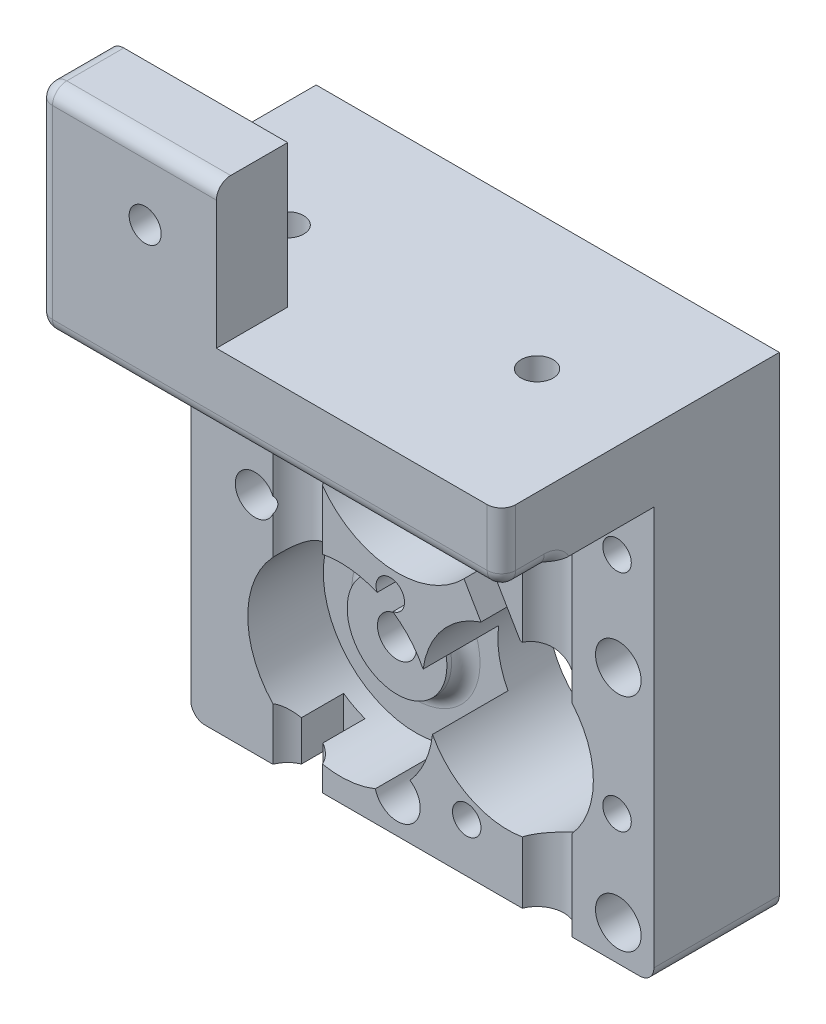
from build123d import *
from build123d.topology import SkipClean

# Parameters (mm, degrees)
SKETCH1_W                = 65
SKETCH1_H                = 68
SKETCH1_R                = 12
SKETCH1_R_2              = 1.75
SKETCH1_R_3              = 2.75
BOSS_EXTRUDE1_DEPTH      = 7
SKETCH2_R                = 7
SKETCH2_R_2              = 2.75
SKETCH2_R_3              = 4
BOSS_EXTRUDE2_DEPTH      = 2.65
SKETCH3_W                = 22
SKETCH3_H                = 10
BOSS_EXTRUDE3_DEPTH      = 65
SKETCH4_R                = 2.25
CUT_EXTRUDE1_DEPTH       = 10
SKETCH5_R                = 2.25
CUT_EXTRUDE2_DEPTH       = 10
BOSS_EXTRUDE5_START      = 5.9
SKETCH7_W                = 41
SKETCH7_H                = 41
SKETCH7_R                = 12
SKETCH7_R_2              = 1.75
BOSS_EXTRUDE5_DEPTH      = 5.9
SKETCH8_R                = 4
SKETCH8_R_2              = 2.75
BOSS_EXTRUDE6_DEPTH      = 7.95
CUT_EXTRUDE3_START       = -9.45
SKETCH10_R               = 2.75
CUT_EXTRUDE3_DEPTH       = 9.45
SKETCH11_W               = 65
SKETCH11_H               = 58
SKETCH11_R               = 1.75
SKETCH11_R_2             = 10
SKETCH11_R_3             = 4
SKETCH11_R_4             = 7.25
BOSS_EXTRUDE7_DEPTH      = 10
CUT_EXTRUDE4_DEPTH       = 7.35
CUT_EXTRUDE5_START       = -10
SKETCH13_R               = 7
CUT_EXTRUDE5_DEPTH       = 10
SKETCH14_R               = 3
CUT_EXTRUDE6_DEPTH       = 17
SKETCH15_R               = 3
SKETCH15_W               = 13.5
SKETCH15_H               = 6.252863579
BOSS_EXTRUDE9_DEPTH      = 3.5
SKETCH16_R               = 3
BOSS_EXTRUDE10_DEPTH     = 7.5
SKETCH17_W               = 65
SKETCH17_H               = 58
SKETCH17_R               = 3
BOSS_EXTRUDE11_DEPTH     = 3
SKETCH18_R               = 2.25
CUT_EXTRUDE7_DEPTH       = 91.140168626
SKETCH19_R               = 3.75
CUT_EXTRUDE8_DEPTH       = 58
FILLET2_R                = 2
CUT_EXTRUDE9_DEPTH       = 5.5
CUT_EXTRUDE10_DEPTH      = 29.5
SKETCH22_W               = 65
SKETCH22_H               = 58
CUT_EXTRUDE11_DEPTH      = 21.4
SKETCH23_R               = 1.8
CUT_EXTRUDE12_DEPTH      = 10
SKETCH24_R               = 2
CUT_EXTRUDE13_DEPTH      = 4
SKETCH26_W               = 41
SKETCH26_H               = 41
CUT_EXTRUDE14_DEPTH      = 5.9
BOSS_EXTRUDE12_START     = -10
BOSS_EXTRUDE12_DEPTH     = 10.6
BOSS_EXTRUDE13_DEPTH     = 0.6
SKETCH28_R               = 3.75
CUT_EXTRUDE15_DEPTH      = 58
CUT_EXTRUDE16_DEPTH      = 10
CUT_EXTRUDE16_DEPTH_BACK = 14
SKETCH32_R               = 3.2
CUT_EXTRUDE17_REACH      = 88.951
SKETCH34_R               = 11
SKETCH34_R_2             = 7
SKETCH35_R               = 12
CUT_EXTRUDE18_DEPTH      = 87.951135754
FILLET4_R                = 2
SKETCH36_R               = 3.2
SKETCH36_R_2             = 1.8
BOSS_EXTRUDE14_DEPTH     = 6.5
SKETCH37_W               = 40
SKETCH37_H               = 20
CUT_EXTRUDE19_DEPTH      = 86.892374568
CUT_EXTRUDE20_REACH      = 85.633
SKETCH38_R               = 13
SKETCH38_R_2             = 9


# Some blends are built 0.0001 mm under size
with BuildPart() as part:
    # Sketch1 → Boss-Extrude1 (new body)
    with BuildSketch(Plane.XY):
        with Locations((-12, 13.5)):
            Rectangle(SKETCH1_W, SKETCH1_H)
        Circle(SKETCH1_R, mode=Mode.SUBTRACT)
        with Locations((-15.5, 15.5)):
            Circle(SKETCH1_R_2, mode=Mode.SUBTRACT)
        with Locations((15.5, 15.5)):
            Circle(SKETCH1_R_2, mode=Mode.SUBTRACT)
        with Locations((15.5, -15.5)):
            Circle(SKETCH1_R_2, mode=Mode.SUBTRACT)
        with Locations((-15.5, -15.5)):
            Circle(SKETCH1_R_2, mode=Mode.SUBTRACT)
        with Locations((-15.5, 24.5)):
            Circle(SKETCH1_R_3, mode=Mode.SUBTRACT)
    extrude(amount=BOSS_EXTRUDE1_DEPTH)

    # Sketch2 → Boss-Extrude2 (add)
    # profile 1 of 3: a face of its own
    with BuildSketch(Plane.XY.offset(7)):
        with Locations((-23.5, -4.247136421)):
            Circle(SKETCH2_R)
        with Locations((-23.5, -4.247136421)):
            Circle(SKETCH2_R_2, mode=Mode.SUBTRACT)
    # profile 2 of 3: a face of its own
    with BuildSketch(Plane.XY.offset(7)):
        with Locations((-15.5, 24.5)):
            Circle(SKETCH2_R)
        with Locations((-15.5, 24.5)):
            Circle(SKETCH2_R_2, mode=Mode.SUBTRACT)
    # profile 3 of 3: a face of its own
    with BuildSketch(Plane.XY.offset(7)):
        with Locations((-35.5, 11)):
            Circle(SKETCH2_R_3)
        with Locations((-35.5, 11)):
            Circle(SKETCH2_R_2, mode=Mode.SUBTRACT)
    extrude(amount=BOSS_EXTRUDE2_DEPTH)

    # Sketch3 → Boss-Extrude3 (add, through all)
    with BuildSketch(Plane(origin=(20.5, 0, 0), x_dir=(0, 0, -1), z_dir=(1, 0, 0))):
        with Locations((-18, 42.5)):
            Rectangle(SKETCH3_W, SKETCH3_H)
        Polygon((-29, 37.5), (-29, 47.5), (-29, 67.5), (-39, 67.5), (-39, 37.5), align=None)
    extrude(amount=-BOSS_EXTRUDE3_DEPTH)

    # Sketch4 → Cut-Extrude1 (cut)
    with BuildSketch(Plane.XY.offset(39)):
        with Locations((-29.5, 57.5)):
            Circle(SKETCH4_R)
        with Locations((5.5, 57.5)):
            Circle(SKETCH4_R)
    extrude(amount=-CUT_EXTRUDE1_DEPTH, mode=Mode.SUBTRACT)

    # Sketch5 → Cut-Extrude2 (cut)
    with BuildSketch(Plane.XZ.offset(-37.5)):
        with Locations(Location((-29.5, 19, 0), (0, 0, 270))):
            Circle(SKETCH5_R)
        with Locations(Location((5.5, 19, 0), (0, 0, 270))):
            Circle(SKETCH5_R)
    extrude(amount=-CUT_EXTRUDE2_DEPTH, mode=Mode.SUBTRACT)

    # Sketch7 → Boss-Extrude5 (add)
    with SkipClean():  # the faces are left unmerged after this step: merging them gives an invalid solid
        with BuildSketch(Plane(origin=(0, 0, 0), x_dir=(-1, 0, 0), z_dir=(0, 0, -1)).offset(BOSS_EXTRUDE5_START)):
            Rectangle(SKETCH7_W, SKETCH7_H)
            Circle(SKETCH7_R, mode=Mode.SUBTRACT)
            with Locations((-15.5, 15.5)):
                Circle(SKETCH7_R_2, mode=Mode.SUBTRACT)
            with Locations((15.5, 15.5)):
                Circle(SKETCH7_R_2, mode=Mode.SUBTRACT)
            with Locations((15.5, -15.5)):
                Circle(SKETCH7_R_2, mode=Mode.SUBTRACT)
            with Locations((-15.5, -15.5)):
                Circle(SKETCH7_R_2, mode=Mode.SUBTRACT)
        extrude(amount=-BOSS_EXTRUDE5_DEPTH)

    # Sketch8 → Boss-Extrude6 (add)
    with SkipClean():  # the faces are left unmerged after this step: merging them gives an invalid solid
        with BuildSketch(Plane.XY.offset(9.65)):
            with Locations((-35.5, 11)):
                Circle(SKETCH8_R)
            with Locations((-35.5, 11)):
                Circle(SKETCH8_R_2, mode=Mode.SUBTRACT)
        extrude(amount=BOSS_EXTRUDE6_DEPTH)

    # Sketch10 → Cut-Extrude3 (cut)
    with SkipClean():  # the faces are left unmerged after this step: merging them gives an invalid solid
        with BuildSketch(Plane.XY.offset(7).offset(CUT_EXTRUDE3_START)):
            with Locations((-35.5, 11)):
                Circle(SKETCH10_R)
            with Locations((-23.5, -4.247136421)):
                Circle(SKETCH10_R)
        extrude(amount=CUT_EXTRUDE3_DEPTH, mode=Mode.SUBTRACT)

    # Sketch11 → Boss-Extrude7 (add)
    with BuildSketch(Plane.XY.offset(7)):
        with Locations((-12, 8.5)):
            Rectangle(SKETCH11_W, SKETCH11_H)
        with Locations(Location((-15.5, -15.5, 0), (0, 0, 180))):
            Circle(SKETCH11_R, mode=Mode.SUBTRACT)
        with Locations((-23.5, -4.247136421)):
            Circle(SKETCH11_R_2, mode=Mode.SUBTRACT)
        with Locations(Location((15.5, -15.5, 0), (0, 0, 180))):
            Circle(SKETCH11_R, mode=Mode.SUBTRACT)
        with Locations((-35.5, 11)):
            Circle(SKETCH11_R_3, mode=Mode.SUBTRACT)
        with BuildLine():
            ThreePointArc((-17.00948247, 14.614583333), (-15.5, 34.5), (-13.99051753, 14.614583333))
            ThreePointArc((-13.99051753, 14.614583333), (-15.5, 13.75), (-17.00948247, 14.614583333))
        make_face(mode=Mode.SUBTRACT)
        with Locations(Location((15.5, 15.5, 0), (0, 0, 180))):
            Circle(SKETCH11_R, mode=Mode.SUBTRACT)
        Circle(SKETCH11_R_4, mode=Mode.SUBTRACT)
    extrude(amount=BOSS_EXTRUDE7_DEPTH)

    # Sketch12 → Cut-Extrude4 (cut)
    with BuildSketch(Plane.XY.offset(17)):
        with BuildLine():
            Line((-11.616421851, 26.773284135), (3.020560783, 1.768109883))
            ThreePointArc((3.020560783, 1.768109883), (2.742169013, -2.174973357), (-1.033978515, -3.34378355))
            Line((-1.033978515, -3.34378355), (-21.284331754, 2.918114044))
            ThreePointArc((-21.284331754, 2.918114044), (-27.95154401, 1.788901677), (-31, -4.247136421))
            Line((-31, -4.247136421), (-31, -20.5))
            Line((-31, -20.5), (-28, -20.5))
            Line((-28, -20.5), (-28, -4.247136421))
            ThreePointArc((-28, -4.247136421), (-26.170926406, -0.625513562), (-22.170599052, 0.052013858))
            Line((-22.170599052, 0.052013858), (-1.920245813, -6.209883736))
            ThreePointArc((-1.920245813, -6.209883736), (5.092599595, -4.039236235), (5.609612882, 3.28363264))
            Line((5.609612882, 3.28363264), (-9.027369751, 28.288806892))
            ThreePointArc((-9.027369751, 28.288806892), (-11.769453907, 31.006383469), (-15.5, 32))
            Line((-15.5, 32), (-44.5, 32))
            Line((-44.5, 32), (-44.5, 29))
            Line((-44.5, 29), (-15.5, 29))
            ThreePointArc((-15.5, 29), (-13.261672344, 28.403830081), (-11.616421851, 26.773284135))
        make_face()
    extrude(amount=-CUT_EXTRUDE4_DEPTH, mode=Mode.SUBTRACT)

    # Sketch13 → Cut-Extrude5 (cut)
    # profile 1 of 2: a face of its own
    with BuildSketch(Plane.XY.offset(17).offset(CUT_EXTRUDE5_START)):
        with BuildLine():
            Line((-15.5, 34.5), (-44.5, 34.5))
            Line((-44.5, 34.5), (-44.5, 14.5))
            Line((-44.5, 14.5), (-15.5, 14.5))
            ThreePointArc((-15.5, 14.5), (-5.5, 24.5), (-15.5, 34.5))
        make_face()
        with Locations((-15.5, 24.5)):
            Circle(SKETCH13_R, mode=Mode.SUBTRACT)
    # profile 2 of 2: a face of its own
    with BuildSketch(Plane.XY.offset(17).offset(CUT_EXTRUDE5_START)):
        with BuildLine():
            Line((-23.5, 5.752863579), (-44.5, 5.752863579))
            Line((-44.5, 5.752863579), (-44.5, -14.247136421))
            Line((-44.5, -14.247136421), (-23.5, -14.247136421))
            ThreePointArc((-23.5, -14.247136421), (-13.5, -4.247136421), (-23.5, 5.752863579))
        make_face()
        with Locations((-23.5, -4.247136421)):
            Circle(SKETCH13_R, mode=Mode.SUBTRACT)
    extrude(amount=CUT_EXTRUDE5_DEPTH, mode=Mode.SUBTRACT)

    # Sketch14 → Cut-Extrude6 (cut)
    with BuildSketch(Plane.XY.offset(17)):
        with Locations((15.5, 15.5)):
            Circle(SKETCH14_R)
        with Locations((15.5, -15.5)):
            Circle(SKETCH14_R)
        with Locations((-15.5, -15.5)):
            Circle(SKETCH14_R)
        with Locations((-15.5, 15.5)):
            Circle(SKETCH14_R)
    extrude(amount=-CUT_EXTRUDE6_DEPTH, mode=Mode.SUBTRACT)

    # Sketch15 → Boss-Extrude9 (add)
    # profile 1 of 3: a face of its own
    with BuildSketch(Plane.XY.offset(17)):
        with BuildLine():
            Line((-44.5, 37.5), (20.5, 37.5))
            Line((20.5, 37.5), (20.5, -20.5))
            Line((20.5, -20.5), (-28, -20.5))
            Line((-28, -20.5), (-28, -14.247136421))
            Line((-28, -14.247136421), (-23.5, -14.247136421))
            ThreePointArc((-23.5, -14.247136421), (-15.864247386, -10.70432482), (-13.638901361, -2.586192825))
            Line((-13.638901361, -2.586192825), (-4.98822277, -5.261191271))
            ThreePointArc((-4.98822277, -5.261191271), (5.680207241, -4.505301955), (3.987342691, 6.055047338))
            Line((3.987342691, 6.055047338), (-5.685956151, 22.58048357))
            ThreePointArc((-5.685956151, 22.58048357), (-7.78005297, 30.856289629), (-15.5, 34.5))
            Line((-15.5, 34.5), (-44.5, 34.5))
            Line((-44.5, 34.5), (-44.5, 37.5))
        make_face()
        with Locations((15.5, 15.5)):
            Circle(SKETCH15_R, mode=Mode.SUBTRACT)
        with Locations((15.5, -15.5)):
            Circle(SKETCH15_R, mode=Mode.SUBTRACT)
        with Locations((-15.5, -15.5)):
            Circle(SKETCH15_R, mode=Mode.SUBTRACT)
    # profile 2 of 3: a face of its own
    with BuildSketch(Plane.XY.offset(17)):
        with BuildLine():
            Line((-26.987212009, 5.752863579), (-23.5, 5.752863579))
            ThreePointArc((-23.5, 5.752863579), (-18.60674686, 4.473876921), (-14.965174817, 0.964078321))
            Line((-14.965174817, 0.964078321), (-7.099804938, -1.468083732))
            ThreePointArc((-7.099804938, -1.468083732), (-5.680207241, 4.505301955), (-0.18689792, 7.247590577))
            Line((-0.18689792, 7.247590577), (-7.105071526, 19.066292618))
            ThreePointArc((-7.105071526, 19.066292618), (-9.465636422, 16.525888375), (-12.551889075, 14.944444444))
            ThreePointArc((-12.551889075, 14.944444444), (-15.269861413, 12.50884032), (-18.328427125, 14.5))
            Line((-18.328427125, 14.5), (-26.132503002, 14.5))
            ThreePointArc((-26.132503002, 14.5), (-25.547400002, 10.027501522), (-26.987212009, 5.752863579))
        make_face()
    # profile 3 of 3: a face of its own
    with BuildSketch(Plane.XY.offset(17)):
        with Locations((-37.75, -17.373568211)):
            Rectangle(SKETCH15_W, SKETCH15_H)
    extrude(amount=BOSS_EXTRUDE9_DEPTH)

    # Sketch16 → Boss-Extrude10 (add)
    # profile 1 of 2: a face of its own
    with BuildSketch(Plane.XY.offset(20.5)):
        with BuildLine():
            Line((-15.5, 34.5), (-44.5, 34.5))
            Line((-44.5, 34.5), (-44.5, 15.358898944))
            ThreePointArc((-44.5, 15.358898944), (-25.5, 11), (-44.5, 6.641101056))
            Line((-44.5, 6.641101056), (-44.5, -20.5))
            Line((-44.5, -20.5), (-28, -20.5))
            Line((-28, -20.5), (-28, -14.247136421))
            Line((-28, -14.247136421), (-23.5, -14.247136421))
            ThreePointArc((-23.5, -14.247136421), (-15.864247386, -10.70432482), (-13.638901361, -2.586192825))
            Line((-13.638901361, -2.586192825), (-4.98822277, -5.261191271))
            ThreePointArc((-4.98822277, -5.261191271), (5.680207241, -4.505301955), (3.987342691, 6.055047338))
            Line((3.987342691, 6.055047338), (-5.685956151, 22.58048357))
            ThreePointArc((-5.685956151, 22.58048357), (-7.78005297, 30.856289629), (-15.5, 34.5))
        make_face()
        with Locations((-15.5, 15.5)):
            Circle(SKETCH16_R, mode=Mode.SUBTRACT)
    # profile 2 of 2: a face of its own
    with BuildSketch(Plane.XY.offset(20.5)):
        with BuildLine():
            Line((-31.177050983, 37.5), (-44.5, 37.5))
            Line((-44.5, 37.5), (-44.5, 34.5))
            Line((-44.5, 34.5), (-15.5, 34.5))
            ThreePointArc((-15.5, 34.5), (-7.78005297, 30.856289629), (-5.685956151, 22.58048357))
            Line((-5.685956151, 22.58048357), (3.987342691, 6.055047338))
            ThreePointArc((3.987342691, 6.055047338), (5.680207241, -4.505301955), (-4.98822277, -5.261191271))
            Line((-4.98822277, -5.261191271), (-13.638901361, -2.586192825))
            ThreePointArc((-13.638901361, -2.586192825), (-15.864247386, -10.70432482), (-23.5, -14.247136421))
            Line((-23.5, -14.247136421), (-28, -14.247136421))
            Line((-28, -14.247136421), (-28, -20.5))
            Line((-28, -20.5), (20.5, -20.5))
            Line((20.5, -20.5), (20.5, 37.5))
            Line((20.5, 37.5), (7.177050983, 37.5))
            Line((7.177050983, 37.5), (3.822949017, 37.5))
            Line((3.822949017, 37.5), (-27.822949017, 37.5))
            Line((-27.822949017, 37.5), (-31.177050983, 37.5))
        make_face()
        with Locations((-15.5, -15.5)):
            Circle(SKETCH16_R, mode=Mode.SUBTRACT)
        with Locations((15.5, 15.5)):
            Circle(SKETCH16_R, mode=Mode.SUBTRACT)
        with Locations((15.5, -15.5)):
            Circle(SKETCH16_R, mode=Mode.SUBTRACT)
    extrude(amount=BOSS_EXTRUDE10_DEPTH)

    # Sketch17 → Boss-Extrude11 (add)
    with BuildSketch(Plane.XY.offset(28)):
        with Locations((-12, 8.5)):
            Rectangle(SKETCH17_W, SKETCH17_H)
        with Locations((-15.5, 15.5)):
            Circle(SKETCH17_R, mode=Mode.SUBTRACT)
        with Locations((15.5, 15.5)):
            Circle(SKETCH17_R, mode=Mode.SUBTRACT)
        with Locations((15.5, -15.5)):
            Circle(SKETCH17_R, mode=Mode.SUBTRACT)
        with Locations((-15.5, -15.5)):
            Circle(SKETCH17_R, mode=Mode.SUBTRACT)
    extrude(amount=BOSS_EXTRUDE11_DEPTH)

    # Sketch18 → Cut-Extrude7 (cut, through all)
    with BuildSketch(Plane(origin=(0, 47.5, 0), x_dir=(1, 0, 0), z_dir=(0, 1, 0))):
        with Locations(Location((-29.5, -19, 0), (0, 0, 90))):
            Circle(SKETCH18_R)
        with Locations(Location((5.5, -19, 0), (0, 0, 90))):
            Circle(SKETCH18_R)
    extrude(amount=-CUT_EXTRUDE7_DEPTH, mode=Mode.SUBTRACT)

    # Sketch19 → Cut-Extrude8 (cut)
    with BuildSketch(Plane.XZ.offset(20.5)):
        with Locations(Location((-29.5, 19, 0), (0, 0, 270))):
            Circle(SKETCH19_R)
        with Locations(Location((5.5, 19, 0), (0, 0, 270))):
            Circle(SKETCH19_R)
    extrude(amount=-CUT_EXTRUDE8_DEPTH, mode=Mode.SUBTRACT)

    # Fillet2
    fillet2_edges = [part.edges().sort_by_distance(p)[0] for p in [
        (-44.5, 37.5, 35),
        (20.5, 37.5, 35),
        (-44.5, 8.5, 31),
        (-12, -20.5, 31),
        (20.5, 8.5, 31),
        (-12, 37.5, 31),
        (20.5, 52.5, 39),
        (-12, 37.5, 39),
        (-44.5, 67.5, 34),
        (-12, 67.5, 39),
        (-44.5, 52.5, 39),
        (20.5, 67.5, 34),
        (20.5, -20.5, 12.55),
        (-44.5, -20.5, 15.5),
    ]]
    fillet(fillet2_edges, radius=FILLET2_R - 0.0001)  # a hair under: the kernel refuses the full size

    # Sketch20 → Cut-Extrude9 (cut)
    with BuildSketch(Plane(origin=(0, 0, 0), x_dir=(-1, 0, 0), z_dir=(0, 0, -1))):
        Polygon((13.190598923, 28.5), (10.881197846, 24.5), (13.190598923, 20.5), (17.809401077, 20.5), (20.118802154, 24.5), (17.809401077, 28.5), align=None)
        Polygon((39.5, 13.309401077), (35.5, 15.618802154), (31.5, 13.309401077), (31.5, 8.690598923), (35.5, 6.381197846), (39.5, 8.690598923), align=None)
        Polygon((23.5, 0.371665733), (19.5, -1.937735344), (19.5, -6.556537498), (23.5, -8.865938574), (27.5, -6.556537498), (27.5, -1.937735344), align=None)
    extrude(amount=-CUT_EXTRUDE9_DEPTH, mode=Mode.SUBTRACT)

    # Sketch21 → Cut-Extrude10 (cut)
    with BuildSketch(Plane(origin=(0, 0, 0), x_dir=(-1, 0, 0), z_dir=(0, 0, -1))):
        Polygon((17.953738644, 28.75), (13.046261356, 28.75), (10.592522712, 24.5), (13.046261356, 20.25), (17.953738644, 20.25), (20.407477288, 24.5), align=None)
        Polygon((27.75, -1.793397777), (23.5, 0.660340867), (19.25, -1.793397777), (19.25, -6.700875065), (23.5, -9.154613709), (27.75, -6.700875065), align=None)
    extrude(amount=CUT_EXTRUDE10_DEPTH, mode=Mode.SUBTRACT)

    # Sketch22 → Cut-Extrude11 (cut)
    with BuildSketch(Plane.XY.offset(39)):
        with Locations((-12, 8.5)):
            Rectangle(SKETCH22_W, SKETCH22_H)
    extrude(amount=-CUT_EXTRUDE11_DEPTH, mode=Mode.SUBTRACT)

    # Sketch23 → Cut-Extrude12 (cut)
    with BuildSketch(Plane.XY.offset(17.6)):
        with Locations((-5.770802335, -13.622690081)):
            Circle(SKETCH23_R)
        with Locations((-16.5, 8.436432064)):
            Circle(SKETCH23_R)
        with Locations((15.322226869, 29.126922543)):
            Circle(SKETCH23_R)
        with Locations((15.322226869, -2.351605773)):
            Circle(SKETCH23_R)
    extrude(amount=-CUT_EXTRUDE12_DEPTH, mode=Mode.SUBTRACT)

    # Sketch24 → Cut-Extrude13 (cut)
    with BuildSketch(Plane.XY.offset(17.6)):
        with Locations((-16.5, 8.436432064)):
            Circle(SKETCH24_R)
        with Locations((15.322226869, 29.126922543)):
            Circle(SKETCH24_R)
        with Locations((15.322226869, -2.351605773)):
            Circle(SKETCH24_R)
        with Locations((-5.770802335, -13.622690081)):
            Circle(SKETCH24_R)
    extrude(amount=-CUT_EXTRUDE13_DEPTH, mode=Mode.SUBTRACT)

    # Sketch26 → Cut-Extrude14 (cut)
    with BuildSketch(Plane(origin=(0, 0, -5.9), x_dir=(-1, 0, 0), z_dir=(0, 0, -1))):
        Rectangle(SKETCH26_W, SKETCH26_H)
    extrude(amount=-CUT_EXTRUDE14_DEPTH, mode=Mode.SUBTRACT)

    # Sketch27 → Boss-Extrude12 (add)
    with BuildSketch(Plane.XY.offset(17).offset(BOSS_EXTRUDE12_START)):
        with BuildLine():
            Line((-44.5, 14.5), (-18.328427125, 14.5))
            ThreePointArc((-18.328427125, 14.5), (-18.396805253, 14.719923514), (-18.448110925, 14.944444444))
            ThreePointArc((-18.448110925, 14.944444444), (-25.010999441, 21.411166946), (-23.5, 30.5))
            Line((-23.5, 30.5), (-44.5, 30.5))
            Line((-44.5, 30.5), (-44.5, 14.5))
        make_face()
        with BuildLine():
            Line((-31, -14.247136421), (-31, -10.861514698))
            ThreePointArc((-31, -10.861514698), (-32.614378278, -0.132758143), (-23.5, 5.752863579))
            Line((-23.5, 5.752863579), (-44.5, 5.752863579))
            Line((-44.5, 5.752863579), (-44.5, -14.247136421))
            Line((-44.5, -14.247136421), (-31, -14.247136421))
        make_face()
    extrude(amount=BOSS_EXTRUDE12_DEPTH)

    # Sketch29 → Boss-Extrude13 (add)
    with BuildSketch(Plane.XY.offset(17)):
        with BuildLine():
            Line((-33.563508327, 14.5), (-32.672144385, 14.5))
            Line((-32.672144385, 14.5), (-32.672144385, 13.828998519))
            ThreePointArc((-32.672144385, 13.828998519), (-33.094316726, 14.195729648), (-33.563508327, 14.5))
        make_face()
        with BuildLine():
            Line((-44.5, 5.752863579), (-32.672144385, 5.752863579))
            Line((-32.672144385, 5.752863579), (-32.672144385, 8.171001481))
            ThreePointArc((-32.672144385, 8.171001481), (-38.695729648, 8.594316726), (-37.436491673, 14.5))
            Line((-37.436491673, 14.5), (-44.5, 14.5))
            Line((-44.5, 14.5), (-44.5, 5.752863579))
        make_face()
        with BuildLine():
            Line((-26.327855615, 14.5), (-26.132503002, 14.5))
            ThreePointArc((-26.132503002, 14.5), (-25.503405071, 10.739059736), (-26.327855615, 7.016061323))
            Line((-26.327855615, 7.016061323), (-26.327855615, 14.5))
        make_face()
    extrude(amount=BOSS_EXTRUDE13_DEPTH)

    # Sketch28 → Cut-Extrude15 (cut)
    with BuildSketch(Plane.XZ.offset(20.5)):
        with Locations((-29.5, 19)):
            Circle(SKETCH28_R)
    extrude(amount=-CUT_EXTRUDE15_DEPTH, mode=Mode.SUBTRACT)

    # Sketch32 → Cut-Extrude16 (cut, two sides: drawn at the far end of the back side and taken through both)
    with BuildSketch(Plane(origin=(0, 0, 7), x_dir=(-1, 0, 0), z_dir=(0, 0, -1)).offset(-CUT_EXTRUDE16_DEPTH_BACK)):
        with Locations(Location((-15.5, 15.5, 0), (0, 0, 180))):
            Circle(SKETCH32_R)
        with Locations(Location((15.5, 15.5, 0), (0, 0, 180))):
            Circle(SKETCH32_R)
        with Locations(Location((15.5, -15.5, 0), (0, 0, 180))):
            Circle(SKETCH32_R)
        with Locations(Location((-15.5, -15.5, 0), (0, 0, 180))):
            Circle(SKETCH32_R)
    extrude(amount=CUT_EXTRUDE16_DEPTH + CUT_EXTRUDE16_DEPTH_BACK, mode=Mode.SUBTRACT)

    # Cut-Extrude17: up to this face of the body (flat: up to its plane)
    cut_extrude17_end = Plane(part.part.faces().sort_by_distance((-38.886970722, 4.824556312, 17.6))[0])
    # Sketch34 → Cut-Extrude17 (cut, up to the picked face)
    with BuildSketch(Plane.XY.offset(7), mode=Mode.PRIVATE) as cut_extrude17_sk1:
        with Locations((-15.5, 24.5)):
            Circle(SKETCH34_R)
        with Locations((-15.5, 24.5)):
            Circle(SKETCH34_R_2, mode=Mode.SUBTRACT)
    cut_extrude17_tool1 = split(extrude(cut_extrude17_sk1.sketch, amount=CUT_EXTRUDE17_REACH, mode=Mode.PRIVATE), bisect_by=cut_extrude17_end, keep=Keep.BOTH, mode=Mode.PRIVATE)
    # Sketch34 → Cut-Extrude17 (cut, up to the picked face)
    with BuildSketch(Plane.XY.offset(7), mode=Mode.PRIVATE) as cut_extrude17_sk2:
        with Locations((-23.5, -4.247136421)):
            Circle(SKETCH34_R)
        with Locations((-23.5, -4.247136421)):
            Circle(SKETCH34_R_2, mode=Mode.SUBTRACT)
    cut_extrude17_tool2 = split(extrude(cut_extrude17_sk2.sketch, amount=CUT_EXTRUDE17_REACH, mode=Mode.PRIVATE), bisect_by=cut_extrude17_end, keep=Keep.BOTH, mode=Mode.PRIVATE)
    add(cut_extrude17_tool1.solids().sort_by(Axis((-26.188873, 24.5, 7), (0, 0, 1)))[0], mode=Mode.SUBTRACT)
    add(cut_extrude17_tool2.solids().sort_by(Axis((-34.188873, -4.247136, 7), (0, 0, 1)))[0], mode=Mode.SUBTRACT)

    # Sketch35 → Cut-Extrude18 (cut, through all)
    with BuildSketch(Plane(origin=(0, 0, 7), x_dir=(-1, 0, 0), z_dir=(0, 0, -1))):
        with Locations(Location((0, 0, 0), (0, 0, 0.225106715))):
            Circle(SKETCH35_R)
    extrude(amount=-CUT_EXTRUDE18_DEPTH, mode=Mode.SUBTRACT)

    # Fillet4
    # the kernel refuses this fillet: 2 mm, written as the material it adds along each edge
    with BuildSketch(Plane(origin=(-15.5, 24.5, 7), x_dir=(0.38988420816742536, -0.9208638901714301, 0), z_dir=(0.9208638901714301, 0.38988420816742536, 0))) as fillet4_piece_1_section:
        with BuildLine():
            CenterArc((7 + FILLET4_R, -FILLET4_R), FILLET4_R, 90, 90)
            Line((7 + FILLET4_R, 0), (7, 0))
            Line((7, 0), (7, -FILLET4_R))
        make_face()
    fillet4_piece_1 = revolve(axis=Axis((-15.5, 24.5, 7), (0, 0, -1)), revolution_arc=292.947294689, mode=Mode.PRIVATE)
    fillet4_piece_1 = fillet4_piece_1 - Plane(origin=(-15.5, 15.5, 7.510265651), x_dir=(1, 0, 0), z_dir=(0, 0, 1)) * Cylinder(3.2, 36, mode=Mode.PRIVATE)
    add(fillet4_piece_1)
    with BuildSketch(Plane(origin=(-23.5, -4.247136421, 7), x_dir=(1, 0, 0), z_dir=(0, -1, 0))) as fillet4_piece_2:
        with BuildLine():
            CenterArc((7 + FILLET4_R, FILLET4_R), FILLET4_R, 180, 90)
            Line((7, FILLET4_R), (7, 0))
            Line((7, 0), (7 + FILLET4_R, 0))
        make_face()
    revolve(axis=Axis((-23.5, -4.247136421, 7), (0, 0, 1)))
    with BuildSketch(Plane(origin=(-15.5, 24.5, 7), x_dir=(1, 0, 0), z_dir=(0, 1, 0))) as fillet4_piece_3_section:
        with BuildLine():
            CenterArc((7 + FILLET4_R, -FILLET4_R), FILLET4_R, 90, 90)
            Line((7 + FILLET4_R, 0), (7, 0))
            Line((7, 0), (7, -FILLET4_R))
        make_face()
    fillet4_piece_3 = revolve(axis=Axis((-15.5, 24.5, 7), (0, 0, -1)), revolution_arc=112.82875521, mode=Mode.PRIVATE)
    fillet4_piece_3 = fillet4_piece_3 - Plane(origin=(-15.5, 15.5, 7.441647914), x_dir=(1, 0, 0), z_dir=(0, 0, 1)) * Cylinder(3.2, 36, mode=Mode.PRIVATE)
    add(fillet4_piece_3)

    # Sketch36 → Boss-Extrude14 (add)
    # profile 1 of 4: a face of its own
    with BuildSketch(Plane(origin=(0, 0, 0), x_dir=(-1, 0, 0), z_dir=(0, 0, -1))):
        with Locations(Location((-15.5, 15.5, 0), (0, 0, 180))):
            Circle(SKETCH36_R)
        with Locations((-15.5, 15.5)):
            Circle(SKETCH36_R_2, mode=Mode.SUBTRACT)
    # profile 2 of 4: a face of its own
    with BuildSketch(Plane(origin=(0, 0, 0), x_dir=(-1, 0, 0), z_dir=(0, 0, -1))):
        with Locations(Location((15.5, 15.5, 0), (0, 0, 169.759651679))):
            Circle(SKETCH36_R)
        with Locations((15.5, 15.5)):
            Circle(SKETCH36_R_2, mode=Mode.SUBTRACT)
    # profile 3 of 4: a face of its own
    with BuildSketch(Plane(origin=(0, 0, 0), x_dir=(-1, 0, 0), z_dir=(0, 0, -1))):
        with Locations(Location((15.5, -15.5, 0), (0, 0, 79.921391245))):
            Circle(SKETCH36_R)
        with Locations((15.5, -15.5)):
            Circle(SKETCH36_R_2, mode=Mode.SUBTRACT)
    # profile 4 of 4: a face of its own
    with BuildSketch(Plane(origin=(0, 0, 0), x_dir=(-1, 0, 0), z_dir=(0, 0, -1))):
        with Locations(Location((-15.5, -15.5, 0), (0, 0, 180))):
            Circle(SKETCH36_R)
        with Locations((-15.5, -15.5)):
            Circle(SKETCH36_R_2, mode=Mode.SUBTRACT)
    extrude(amount=-BOSS_EXTRUDE14_DEPTH)

    # Sketch37 → Cut-Extrude19 (cut, through all)
    with BuildSketch(Plane(origin=(0, 0, 29), x_dir=(-1, 0, 0), z_dir=(0, 0, -1))):
        with Locations((-0.5, 57.5)):
            Rectangle(SKETCH37_W, SKETCH37_H)
    extrude(amount=-CUT_EXTRUDE19_DEPTH, mode=Mode.SUBTRACT)

    # Cut-Extrude20: up to this face of the body (flat: up to its plane)
    cut_extrude20_end = Plane(part.part.faces().sort_by_distance((-30.688873016, -13.270505656, 7))[0])
    # Sketch38 → Cut-Extrude20 (cut, up to the picked face)
    with BuildSketch(Plane.XY.offset(17.6), mode=Mode.PRIVATE) as cut_extrude20_sk1:
        with Locations((-23.5, -4.247136421)):
            Circle(SKETCH38_R)
        with Locations((-23.5, -4.247136421)):
            Circle(SKETCH38_R_2, mode=Mode.SUBTRACT)
    cut_extrude20_tool1 = split(extrude(cut_extrude20_sk1.sketch, amount=-CUT_EXTRUDE20_REACH, mode=Mode.PRIVATE), bisect_by=cut_extrude20_end, keep=Keep.BOTH, mode=Mode.PRIVATE)
    # Sketch38 → Cut-Extrude20 (cut, up to the picked face)
    with BuildSketch(Plane.XY.offset(17.6), mode=Mode.PRIVATE) as cut_extrude20_sk2:
        with BuildLine():
            Line((-44.5, 34.5), (-44.5, 35.5))
            Line((-44.5, 35.5), (-22.42820323, 35.5))
            ThreePointArc((-22.42820323, 35.5), (-7.441035567, 34.700641758), (-3.19537873, 20.305206155))
            Line((-3.19537873, 20.305206155), (2.20569179, 11.078255979))
            Line((2.20569179, 11.078255979), (1.342674423, 10.573081727))
            Line((1.342674423, 10.573081727), (-2.996518646, 10.067907474))
            Line((-2.996518646, 10.067907474), (-6.154665649, 15.463146241))
            ThreePointArc((-6.154665649, 15.463146241), (-22.642837552, 13.638146028), (-27.5, 29.5))
            Line((-27.5, 29.5), (-44.5, 29.5))
            Line((-44.5, 29.5), (-44.5, 30.5))
            Line((-44.5, 30.5), (-44.5, 34.5))
        make_face()
        with Locations((-15.5, 24.5)):
            Circle(SKETCH38_R_2, mode=Mode.SUBTRACT)
    cut_extrude20_tool2 = split(extrude(cut_extrude20_sk2.sketch, amount=-CUT_EXTRUDE20_REACH, mode=Mode.PRIVATE), bisect_by=cut_extrude20_end, keep=Keep.BOTH, mode=Mode.PRIVATE)
    add(cut_extrude20_tool1.solids().sort_by(Axis((-36.132304, -4.247136, 17.6), (0, 0, -1)))[0], mode=Mode.SUBTRACT)
    add(cut_extrude20_tool2.solids().sort_by(Axis((-36, 30.041659, 17.6), (0, 0, -1)))[0], mode=Mode.SUBTRACT)


solid = part.part
